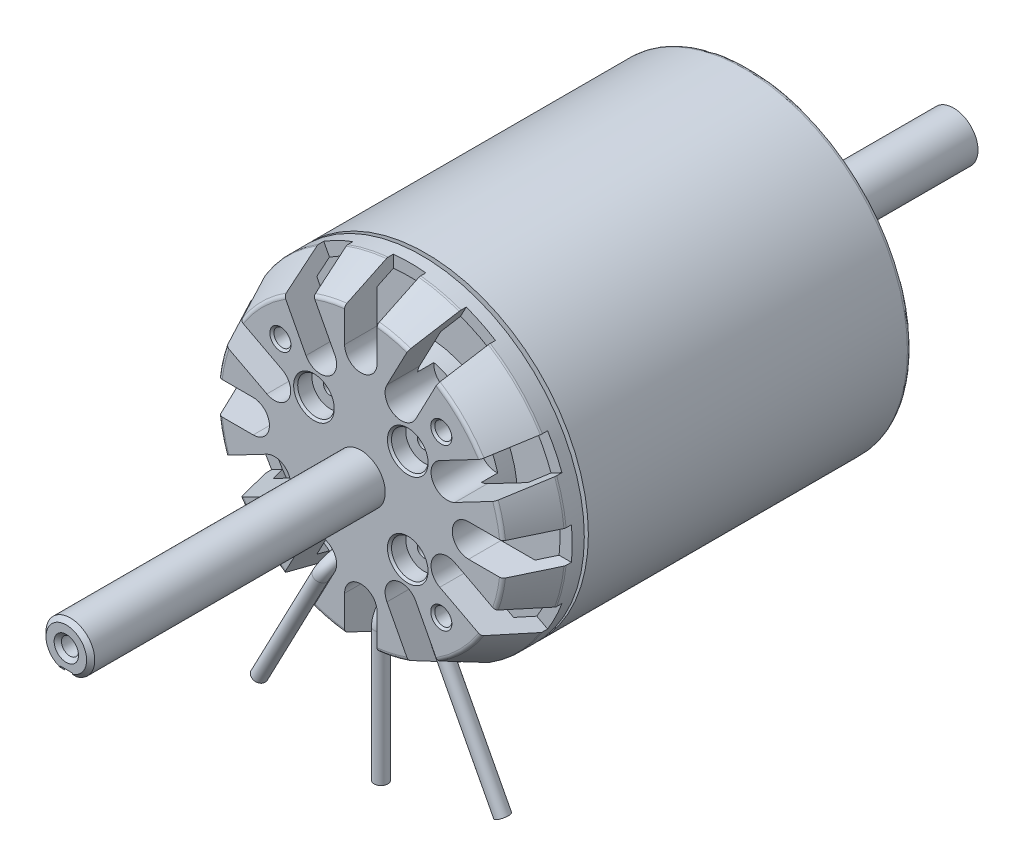
from build123d import *

# Parameters (mm, degrees)
FILLET1_R                   = 1
CUT_EXTRUDE1_DEPTH          = 12
CIRPATTERN1_COUNT           = 4
SKETCH3_R                   = 17.775588002
CUT_EXTRUDE2_DEPTH          = 12
CIRPATTERN2_COUNT           = 4
M5_TAPPED_HOLE1_D           = 4.2
M5_TAPPED_HOLE1_DEPTH       = 12.4
M5_TAPPED_HOLE1_TIP         = 1.2618073
SKETCH6_W                   = 1.65
SKETCH6_H                   = 40
M4_TAPPED_HOLE2_D           = 3.3
M5_TAPPED_HOLE2_D           = 4.2
M5_TAPPED_HOLE2_DEPTH       = 8
M4_TAPPED_HOLE3_D           = 3.3
M4_TAPPED_HOLE3_DEPTH       = 21.5
M4_TAPPED_HOLE3_TIP         = 0.991420021
SKETCH15_R                  = 4.5
CUT_EXTRUDE3_DEPTH          = 4
CHAMFER1_SIZE               = 0.5
SKETCH17_R                  = 1.65
SKETCH18_R                  = 6
BOSS_EXTRUDE1_DEPTH         = 72.5
CUT_EXTRUDE4_REACH          = 138.919
CUT_EXTRUDE4_END_RADIUS     = 6
CUT_EXTRUDE4_START          = -4.5
M5_TAPPED_HOLE3_D           = 4.2
M5_TAPPED_HOLE3_DEPTH       = 24
M5_TAPPED_HOLE3_CSINK_D     = 6
M5_TAPPED_HOLE3_CSINK_ANGLE = 90
M5_TAPPED_HOLE3_TIP         = 1.2618073
BOSS_EXTRUDE2_START         = 38.8
SKETCH22_R                  = 6
BOSS_EXTRUDE2_DEPTH         = 38.8
CHAMFER2_SIZE               = 1
M5_TAPPED_HOLE4_D           = 4.2
M5_TAPPED_HOLE4_DEPTH       = 24
M5_TAPPED_HOLE4_CSINK_D     = 6
M5_TAPPED_HOLE4_CSINK_ANGLE = 90
M5_TAPPED_HOLE4_TIP         = 1.2618073
SKETCH25_W                  = 3
SKETCH25_H                  = 3
CUT_EXTRUDE5_DEPTH          = 70
FILLET2_R                   = 1.5


with BuildPart() as part:
    # Sketch1 → Revolve1 (revolve)
    with BuildSketch(Plane(origin=(0, 0, 0), x_dir=(0, 0, -1), z_dir=(1, 0, 0)), mode=Mode.PRIVATE) as revolve1_sk:
        Polygon((0, 0), (0, 35), (10.5, 40), (15, 40), (15, 37), (12, 37), (8, 35.095238095), (8, 22.5), (15, 22.5), (16, 22.5), (16, 40), (95.1, 40), (107.1, 20), (107.1, 0), align=None)
        with BuildLine():
            Line((92.269048105, 35), (91.1, 35))
            Line((91.1, 35), (91.1, 10))
            ThreePointArc((91.1, 10), (95.937489456, 12.583391961), (99.397863491, 16.837922463))
            ThreePointArc((99.397863491, 16.837922463), (96.590681373, 26.216180606), (92.269048105, 35))
        make_face(mode=Mode.SUBTRACT)
    revolve(revolve1_sk.sketch.rotate(Axis((0, 0, 38.636074766), (0, 0, -1)), 90), axis=Axis((0, 0, 38.636074766), (0, 0, -1)))

    # Fillet1
    fillet1_edges = [part.edges().sort_by_distance(p)[0] for p in [
        (-20, 0, -107.1),
        (-40, 0, -95.1),
        (-40, 0, -10.5),
        (-35, 0, 0),
    ]]
    fillet(fillet1_edges, radius=FILLET1_R)

    # Sketch2 → Cut-Extrude1 (cut)
    with BuildSketch(Plane.XY):
        with BuildLine():
            Line((4, 43.5), (4, 26.5))
            ThreePointArc((4, 26.5), (0, 22.5), (-4, 26.5))
            Line((-4, 26.5), (-4, 43.5))
            ThreePointArc((-4, 43.5), (0, 47.5), (4, 43.5))
        make_face()
        with BuildLine():
            Line((-17.110156168, 43.528296815), (-6.421479662, 23.134424425))
            ThreePointArc((-6.421479662, 23.134424425), (-8.10749571, 17.734669811), (-13.507250323, 19.420685859))
            Line((-13.507250323, 19.420685859), (-24.19592683, 39.814558249))
            ThreePointArc((-24.19592683, 39.814558249), (-22.509910782, 45.214312863), (-17.110156168, 43.528296815))
        make_face()
        with BuildLine():
            Line((24.19592683, 39.814558249), (13.507250323, 19.420685859))
            ThreePointArc((13.507250323, 19.420685859), (8.10749571, 17.734669811), (6.421479662, 23.134424425))
            Line((6.421479662, 23.134424425), (17.110156168, 43.528296815))
            ThreePointArc((17.110156168, 43.528296815), (22.509910782, 45.214312863), (24.19592683, 39.814558249))
        make_face()
    cut_extrude1 = extrude(amount=-CUT_EXTRUDE1_DEPTH, mode=Mode.SUBTRACT)

    # CirPattern1: Cut-Extrude1 ×4 about axis
    cirpattern1_axis = Axis((0, 0, 0), (0, 0, 1))
    for i in range(1, CIRPATTERN1_COUNT):
        add(cut_extrude1.rotate(cirpattern1_axis, i * 360 / CIRPATTERN1_COUNT), mode=Mode.SUBTRACT)

    # Sketch3 → Cut-Extrude2 (cut)
    with BuildSketch(Plane(origin=(0, 0, -107.1), x_dir=(-1, 0, 0), z_dir=(0, 0, -1))):
        with Locations((28.125588002, 28.125588002)):
            Circle(SKETCH3_R)
        with BuildLine():
            Line((5, 44.130872228), (5, 25.23751179))
            ThreePointArc((5, 25.23751179), (0, 20.23751179), (-5, 25.23751179))
            Line((-5, 25.23751179), (-5, 44.130872228))
            ThreePointArc((-5, 44.130872228), (0, 49.130872228), (5, 44.130872228))
        make_face()
    cut_extrude2 = extrude(amount=-CUT_EXTRUDE2_DEPTH, mode=Mode.SUBTRACT)

    # CirPattern2: Cut-Extrude2 ×4 about axis
    cirpattern2_axis = Axis((0, 0, 0), (0, 0, 1))
    for i in range(1, CIRPATTERN2_COUNT):
        add(cut_extrude2.rotate(cirpattern2_axis, i * 360 / CIRPATTERN2_COUNT), mode=Mode.SUBTRACT)

    # M5 Tapped Hole1
    with Locations(Plane(origin=(0, 0, -107.1), x_dir=(-1, 0, 0), z_dir=(0, 0, -1))):
        with Locations((-9.25, 9.25), (9.25, 9.25), (9.25, -9.25), (-9.25, -9.25)):
            Hole(M5_TAPPED_HOLE1_D / 2, depth=M5_TAPPED_HOLE1_DEPTH)
            with Locations((0, 0, -(M5_TAPPED_HOLE1_DEPTH + M5_TAPPED_HOLE1_TIP / 2))):  # 118° drill point
                Cone(0, M5_TAPPED_HOLE1_D / 2, M5_TAPPED_HOLE1_TIP, mode=Mode.SUBTRACT)

    # Sketch6 → M4 Tapped Hole1 (revolve, cut)
    with BuildSketch(Plane(origin=(0, 0, -102.766495656), x_dir=(0, 0, 1), z_dir=(0, 1, 0))):
        with Locations((0.825, 20)):
            Rectangle(SKETCH6_W, SKETCH6_H)
    revolve(axis=Axis((-6.35, 0, -102.766495656), (1, 0, 0)), mode=Mode.SUBTRACT)

    # M4 Tapped Hole2 (through all)
    with Locations(Plane(origin=(0, 0, 0), x_dir=(0, 0, -1), z_dir=(1, 0, 0))):
        with Locations((102.766495656, 0)):
            Hole(M4_TAPPED_HOLE2_D / 2)

    # M5 Tapped Hole2
    with Locations(Plane.XY):
        with Locations((-19.798989873, -19.798989873), (19.798989873, -19.798989873), (19.798989873, 19.798989873), (-19.798989873, 19.798989873)):
            Hole(M5_TAPPED_HOLE2_D / 2, depth=M5_TAPPED_HOLE2_DEPTH)

    # M4 Tapped Hole3
    with Locations(Plane.XY):
        with Locations((-11.543518203, 11.543518203), (11.543518203, 11.543518203), (11.543518203, -11.543518203), (-11.543518203, -11.543518203)):
            Hole(M4_TAPPED_HOLE3_D / 2, depth=M4_TAPPED_HOLE3_DEPTH)
            with Locations((0, 0, -(M4_TAPPED_HOLE3_DEPTH + M4_TAPPED_HOLE3_TIP / 2))):  # 118° drill point
                Cone(0, M4_TAPPED_HOLE3_D / 2, M4_TAPPED_HOLE3_TIP, mode=Mode.SUBTRACT)

    # Sketch15 → Cut-Extrude3 (cut)
    with BuildSketch(Plane.XY):
        with Locations((-11.543518203, -11.543518203)):
            Circle(SKETCH15_R)
        with Locations((11.543518203, -11.543518203)):
            Circle(SKETCH15_R)
        with Locations((11.543518203, 11.543518203)):
            Circle(SKETCH15_R)
        with Locations((-11.543518203, 11.543518203)):
            Circle(SKETCH15_R)
    extrude(amount=-CUT_EXTRUDE3_DEPTH, mode=Mode.SUBTRACT)

    # Chamfer1
    chamfer1_edges = [part.edges().sort_by_distance(p)[0] for p in [
        (-17.698989873, 19.798989873, 0),
        (21.898989873, 19.798989873, 0),
        (21.898989873, -19.798989873, 0),
        (-17.698989873, -19.798989873, 0),
        (-16.043518203, -11.543518203, 0),
        (7.043518203, -11.543518203, 0),
        (7.043518203, 11.543518203, 0),
        (-16.043518203, 11.543518203, 0),
    ]]
    chamfer(chamfer1_edges, length=CHAMFER1_SIZE)

    # Sweep1: sweep along a path in Sketch16
    with BuildLine(Plane(origin=(0, 0, 0), x_dir=(0, 0, -1), z_dir=(1, 0, 0))) as sweep1_path:
        Line((4.956666277, -66.816449859), (4.956666277, -34.106380675))
        ThreePointArc((4.956666277, -34.106380675), (6.421132371, -30.570846769), (9.956666277, -29.106380675))
        Line((9.956666277, -29.106380675), (16, -29.106380675))
    # Sketch17 → Sweep1 (sweep)
    with BuildSketch(Plane.XY.offset(-16)):
        with Locations((0, -29.106380675)):
            Circle(SKETCH17_R)
    sweep1 = sweep(path=sweep1_path.line)

    # Mirror1: Sweep1 across plane
    add(sweep1.mirror(Plane(origin=(0.525879499, -0.12945835, 0), x_dir=(0, 0, 1), z_dir=(0.9710101267941458, -0.23903835186684408, 0))))

    # Mirror2: Sweep1 across plane
    add(sweep1.mirror(Plane(origin=(-0.525879499, -0.12945835, 0), x_dir=(0, 0, 1), z_dir=(0.9710101267941456, 0.23903835186684433, 0))))

    # Sketch18 → Boss-Extrude1 (add)
    with BuildSketch(Plane.XY):
        with Locations(Location((0, 0, 0), (0, 0, 180))):
            Circle(SKETCH18_R)
    extrude(amount=BOSS_EXTRUDE1_DEPTH)

    # Cut-Extrude4: up to this cylinder (the profile starts inside it)
    cut_extrude4_end = Plane(origin=(0, 0, 57.9), z_dir=(0, 0, -1)) * Cylinder(CUT_EXTRUDE4_END_RADIUS, 290.838, mode=Mode.PRIVATE)
    # Sketch19 → Cut-Extrude4 (cut, up to the surface)
    with BuildSketch(Plane(origin=(0, 0, 0), x_dir=(1, 0, 0), z_dir=(0, 1, 0)).offset(CUT_EXTRUDE4_START), mode=Mode.PRIVATE) as cut_extrude4_sk1:
        with BuildLine():
            Line((-1.5, -63.9), (-1.5, -51.9))
            ThreePointArc((-1.5, -51.9), (0, -50.4), (1.5, -51.9))
            Line((1.5, -51.9), (1.5, -63.9))
            ThreePointArc((1.5, -63.9), (0, -65.4), (-1.5, -63.9))
        make_face()
    cut_extrude4_tool1 = extrude(cut_extrude4_sk1.sketch, amount=-CUT_EXTRUDE4_REACH, mode=Mode.PRIVATE) & cut_extrude4_end
    add(cut_extrude4_tool1.solids().sort_by_distance((0, -4.5, 57.9))[0], mode=Mode.SUBTRACT)

    # M5 Tapped Hole3
    with Locations(Plane.XY.offset(72.5)):
        with Locations((0, 0)):
            CounterSinkHole(M5_TAPPED_HOLE3_D / 2, M5_TAPPED_HOLE3_CSINK_D / 2, depth=M5_TAPPED_HOLE3_DEPTH, counter_sink_angle=M5_TAPPED_HOLE3_CSINK_ANGLE)
            with Locations((0, 0, -(M5_TAPPED_HOLE3_DEPTH + M5_TAPPED_HOLE3_TIP / 2))):  # 118° drill point
                Cone(0, M5_TAPPED_HOLE3_D / 2, M5_TAPPED_HOLE3_TIP, mode=Mode.SUBTRACT)

    # Sketch22 → Boss-Extrude2 (add)
    with BuildSketch(Plane(origin=(0, 0, -107.1), x_dir=(-1, 0, 0), z_dir=(0, 0, -1)).offset(BOSS_EXTRUDE2_START)):
        Circle(SKETCH22_R)
    extrude(amount=-BOSS_EXTRUDE2_DEPTH)

    # Chamfer2
    chamfer2_edges = [part.edges().sort_by_distance(p)[0] for p in [
        (6, 0, 72.5),
    ]]
    chamfer(chamfer2_edges, length=CHAMFER2_SIZE)

    # M5 Tapped Hole4
    with Locations(Plane(origin=(0, 0, -145.9), x_dir=(-1, 0, 0), z_dir=(0, 0, -1))):
        with Locations((0, 0)):
            CounterSinkHole(M5_TAPPED_HOLE4_D / 2, M5_TAPPED_HOLE4_CSINK_D / 2, depth=M5_TAPPED_HOLE4_DEPTH, counter_sink_angle=M5_TAPPED_HOLE4_CSINK_ANGLE)
            with Locations((0, 0, -(M5_TAPPED_HOLE4_DEPTH + M5_TAPPED_HOLE4_TIP / 2))):  # 118° drill point
                Cone(0, M5_TAPPED_HOLE4_D / 2, M5_TAPPED_HOLE4_TIP, mode=Mode.SUBTRACT)

    # Sketch25 → Cut-Extrude5 (cut)
    with BuildSketch(Plane.XY.offset(72.5)):
        with Locations((0, -6)):
            Rectangle(SKETCH25_W, SKETCH25_H)
    extrude(amount=-CUT_EXTRUDE5_DEPTH, mode=Mode.SUBTRACT)

    # Fillet2
    fillet2_edges = [part.edges().sort_by_distance(p)[0] for p in [
        (1.5, -5.15473751, 2.5),
        (-1.5, -5.15473751, 2.5),
    ]]
    fillet(fillet2_edges, radius=FILLET2_R - 0.0001)  # a hair under: the kernel refuses the full size


solid = part.part
